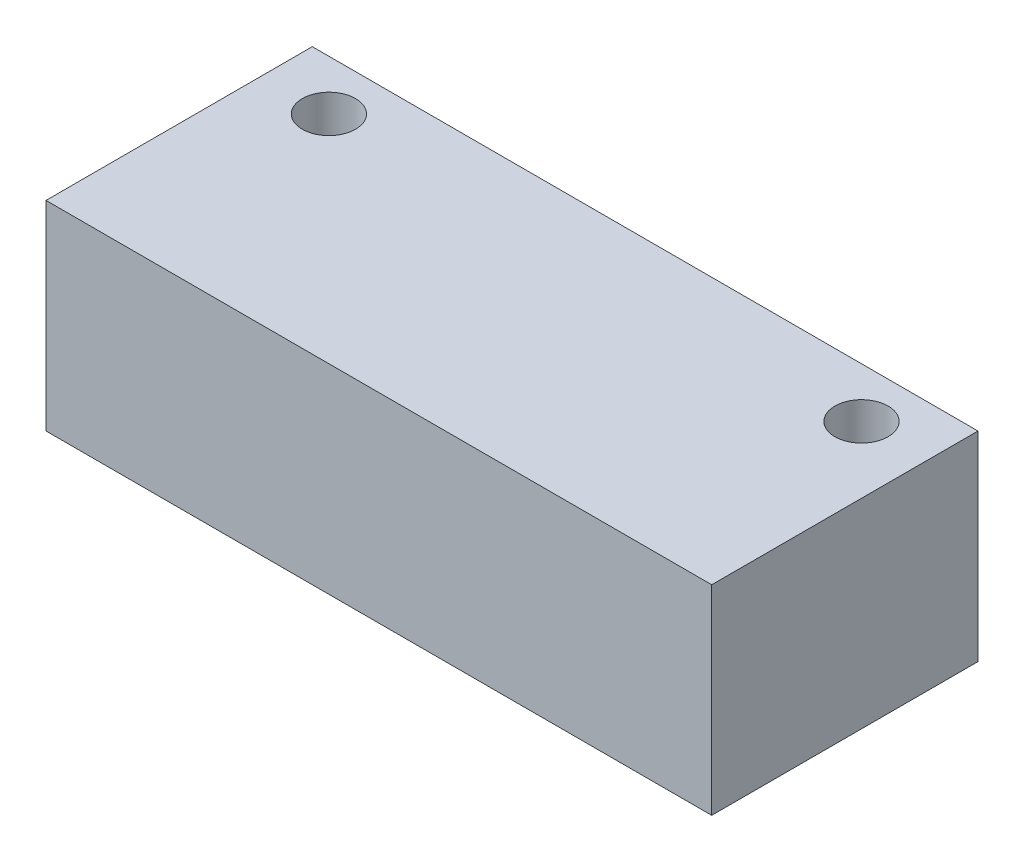
from build123d import *

# Parameters (mm, degrees)
SKETCH1_W           = 40
SKETCH1_H           = 12
BOSS_EXTRUDE1_DEPTH = 16
SKETCH2_R           = 1.6
CUT_EXTRUDE1_DEPTH  = 29.284271247


with BuildPart() as part:
    # Sketch1 → Boss-Extrude1 (new body)
    with BuildSketch(Plane.XY):
        Rectangle(SKETCH1_W, SKETCH1_H)
    extrude(amount=BOSS_EXTRUDE1_DEPTH)

    # Sketch2 → Cut-Extrude1 (cut, through all)
    with BuildSketch(Plane.XZ.offset(6)):
        with Locations((-16, 3)):
            Circle(SKETCH2_R)
        with Locations((16, 3)):
            Circle(SKETCH2_R)
    extrude(amount=-CUT_EXTRUDE1_DEPTH, mode=Mode.SUBTRACT)


solid = part.part
